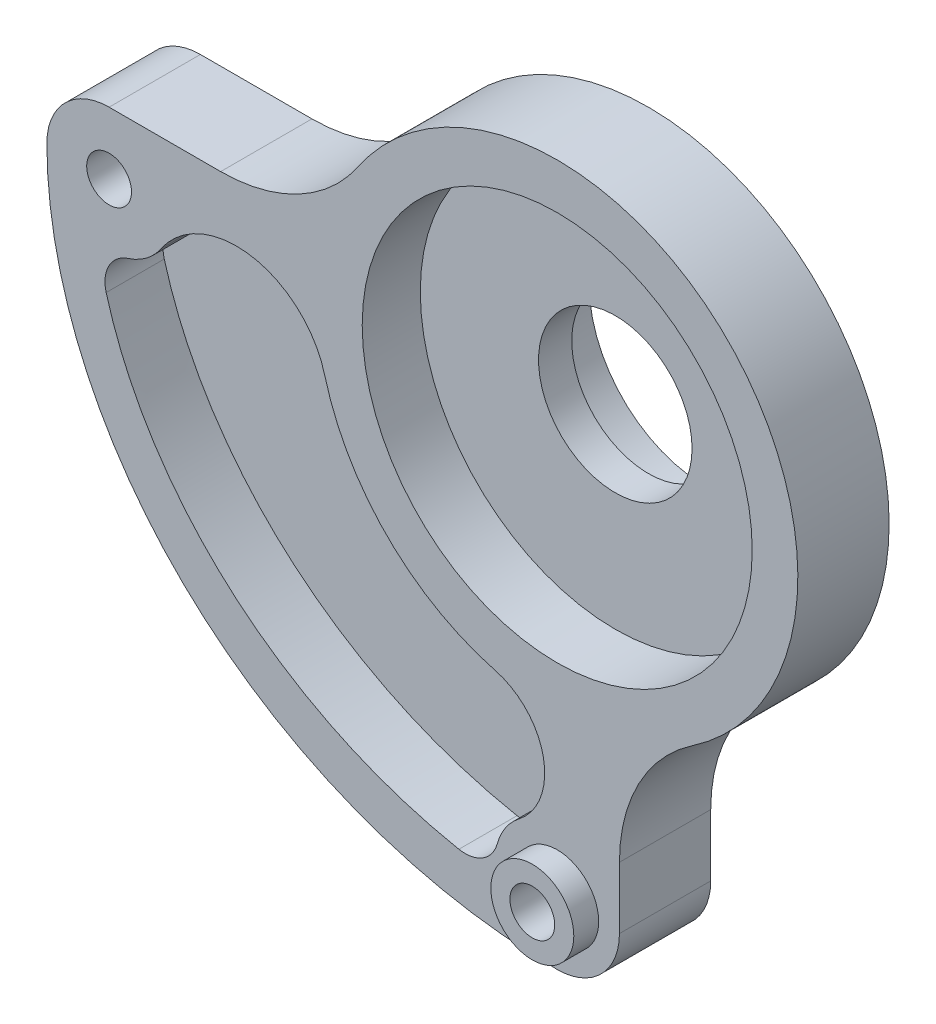
from build123d import *

# Parameters (mm, degrees)
SKETCH1_R           = 8
SKETCH1_R_2         = 7
BOSS_EXTRUDE1_DEPTH = 3.43
SKETCH2_R           = 14.5
SKETCH2_R_2         = 4.625
BOSS_EXTRUDE2_DEPTH = 2
SKETCH3_R           = 11.75
SKETCH3_R_2         = 1.35
BOSS_EXTRUDE3_DEPTH = 3.5
BOSS_EXTRUDE4_START = 2
SKETCH4_R           = 1.35
BOSS_EXTRUDE4_DEPTH = 2
CUT_EXTRUDE1_START  = -3.5
CUT_EXTRUDE1_DEPTH  = 3.5
FILLET1_R           = 2
SKETCH8_R           = 2.5
SKETCH8_R_2         = 1.35
BOSS_EXTRUDE6_DEPTH = 1.5


# Read off the part's stored shape, not the designer's step: Cut-Extrude1
with BuildPart() as part:
    # Sketch1 → Boss-Extrude1 (new body)
    with BuildSketch(Plane.XY):
        with Locations(Location((0, 0, 0), (0, 0, 180))):
            Circle(SKETCH1_R)
        with Locations(Location((0, 0, 0), (0, 0, 180))):
            Circle(SKETCH1_R_2, mode=Mode.SUBTRACT)
    extrude(amount=BOSS_EXTRUDE1_DEPTH)

    # Sketch2 → Boss-Extrude2 (add)
    with BuildSketch(Plane.XY.offset(3.43)):
        Circle(SKETCH2_R)
        Circle(SKETCH2_R_2, mode=Mode.SUBTRACT)
    extrude(amount=BOSS_EXTRUDE2_DEPTH)

    # Sketch3 → Boss-Extrude3 (add)
    with BuildSketch(Plane.XY.offset(5.43)):
        with BuildLine():
            Line((3.75, -24), (3.75, -20.277758752))
            ThreePointArc((3.75, -20.277758752), (4.914773659, -15.593874092), (8.137755102, -12.001122527))
            ThreePointArc((8.137755102, -12.001122527), (10.253048327, 10.253048327), (-12.001122527, 8.137755102))
            ThreePointArc((-12.001122527, 8.137755102), (-15.593874092, 4.914773659), (-20.277758752, 3.75))
            Line((-20.277758752, 3.75), (-27, 3.75))
            ThreePointArc((-27, 3.75), (-29.651650429, 2.651650429), (-30.75, 0))
            add(Edge.make_bspline(
                [(-30.75, 0), (-30.75, -27.75), (0, -27.75)],
                knots=[0, 0, 0, 1.570796327, 1.570796327, 1.570796327], degree=2, weights=[1, 0.707106781, 1]))
            ThreePointArc((0, -27.75), (2.651650429, -26.651650429), (3.75, -24))
        make_face()
        Circle(SKETCH3_R, mode=Mode.SUBTRACT)
        with Locations((0, -24)):
            Circle(SKETCH3_R_2, mode=Mode.SUBTRACT)
        with Locations((-27, 0)):
            Circle(SKETCH3_R_2, mode=Mode.SUBTRACT)
    extrude(amount=BOSS_EXTRUDE3_DEPTH)

    # Sketch4 → Boss-Extrude4 (add)
    with BuildSketch(Plane(origin=(0, 0, 5.43), x_dir=(-1, 0, 0), z_dir=(0, 0, -1)).offset(BOSS_EXTRUDE4_START)):
        with BuildLine():
            Line((-3.75, -20.277758752), (-3.75, -24))
            ThreePointArc((-3.75, -24), (-2.651650429, -26.651650429), (0, -27.75))
            add(Edge.make_bspline(
                [(0, -27.75), (30.75, -27.75), (30.75, 0)],
                knots=[4.71238898, 4.71238898, 4.71238898, 6.283185307, 6.283185307, 6.283185307], degree=2, weights=[1, 0.707106781, 1]))
            ThreePointArc((30.75, 0), (29.651650429, 2.651650429), (27, 3.75))
            Line((27, 3.75), (20.277758752, 3.75))
            ThreePointArc((20.277758752, 3.75), (15.593874092, 4.914773659), (12.001122527, 8.137755102))
            ThreePointArc((12.001122527, 8.137755102), (10.253048327, -10.253048327), (-8.137755102, -12.001122527))
            ThreePointArc((-8.137755102, -12.001122527), (-4.914773659, -15.593874092), (-3.75, -20.277758752))
        make_face()
        with Locations(Location((27, 0, 0), (0, 0, 180))):
            Circle(SKETCH4_R, mode=Mode.SUBTRACT)
        with Locations(Location((0, -24, 0), (0, 0, 180))):
            Circle(SKETCH4_R, mode=Mode.SUBTRACT)
    extrude(amount=-BOSS_EXTRUDE4_DEPTH)

    # Cut-Extrude1 outline → Cut-Extrude1 (cut)
    with BuildSketch(Plane.XY.offset(8.93).offset(CUT_EXTRUDE1_START)):
        with BuildLine():
            ThreePointArc((-23.887668919, -2.091864059), (-25.551843779, -3.459095772), (-27.693722308, -3.685274665))
            add(Edge.make_bspline(
                [(-27.693722308, -3.685274665), (-27.362240175, -5.665830378), (-25.799154504, -10.759842679), (-20.433371513, -18.029392928), (-12.653019422, -22.727558912), (-6.72944223, -24.348951045), (-4.285685075, -24.711452028), (-3.667038232, -24.784430116)],
                knots=[0.149690792, 0.149690792, 0.149690792, 0.149690792, 0.392699082, 0.785398163, 1.178097245, 1.374446786, 1.440624357, 1.440624357, 1.440624357, 1.440624357], degree=3))
            ThreePointArc((-3.667038232, -24.784430116), (-3.522792072, -22.714528875), (-2.300027155, -21.038180444))
            ThreePointArc((-2.300027155, -21.038180444), (-0.83329357, -17.083388646), (-3.725629572, -14.013196791))
            ThreePointArc((-3.725629572, -14.013196791), (-10.247441141, -10.258652449), (-14.009114583, -3.740950226))
            ThreePointArc((-14.009114583, -3.740950226), (-18.417300739, 0.264998128), (-23.887668919, -2.091864059))
        make_face()
    extrude(amount=CUT_EXTRUDE1_DEPTH, mode=Mode.SUBTRACT)

    # Fillet1
    fillet1_edges = [part.edges().sort_by_distance(p)[0] for p in [
        (-3.667038232, -24.784430116, 7.18),
        (-27.693722308, -3.685274665, 7.18),
    ]]
    fillet(fillet1_edges, radius=FILLET1_R)

    # Sketch8 → Boss-Extrude6 (add)
    with BuildSketch(Plane.XY.offset(8.93)):
        with Locations((0, -24)):
            Circle(SKETCH8_R)
        with Locations((0, -24)):
            Circle(SKETCH8_R_2, mode=Mode.SUBTRACT)
    extrude(amount=BOSS_EXTRUDE6_DEPTH)


solid = part.part
